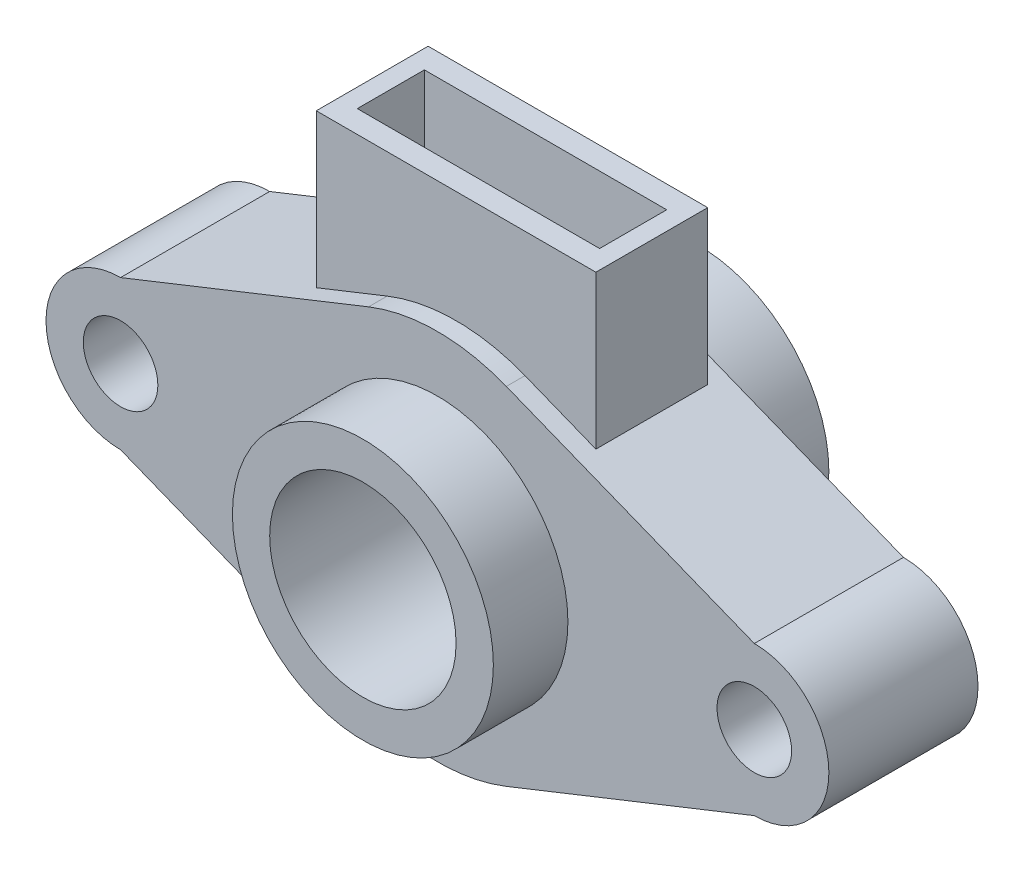
from build123d import *
from build123d.topology import SkipClean

# Parameters (mm, degrees)
SKETCH1_R                = 10
BOSS_EXTRUDE1_DEPTH      = 20
SKETCH2_R                = 35
SKETCH2_R_2              = 25
BOSS_EXTRUDE2_DEPTH      = 20
BOSS_EXTRUDE3_START      = 30
SKETCH3_R                = 35
SKETCH3_R_2              = 25
BOSS_EXTRUDE3_DEPTH      = 30
SKETCH4_R                = 25
CUT_EXTRUDE1_DEPTH       = 131.862523283
BOSS_EXTRUDE6_REACH      = 176.428
BOSS_EXTRUDE6_END_RADIUS = 50
SKETCH6_W                = 75
SKETCH6_H                = 30
SKETCH7_W                = 65
SKETCH7_H                = 18
CUT_EXTRUDE2_DEPTH       = 40


with BuildPart() as part:
    # Sketch1 → Boss-Extrude1 (new, symmetric)
    with BuildSketch(Plane.XY):
        with BuildLine():
            Line((-85, 20), (-18.480117336, 46.459501324))
            ThreePointArc((-18.480117336, 46.459501324), (0, 50), (18.480117336, 46.459501324))
            Line((18.480117336, 46.459501324), (85, 20))
            ThreePointArc((85, 20), (105, 0), (85, -20))
            Line((85, -20), (18.480117336, -46.459501324))
            ThreePointArc((18.480117336, -46.459501324), (0, -50), (-18.480117336, -46.459501324))
            Line((-18.480117336, -46.459501324), (-85, -20))
            ThreePointArc((-85, -20), (-105, 0), (-85, 20))
        make_face()
        with Locations((-85, 0)):
            Circle(SKETCH1_R, mode=Mode.SUBTRACT)
        with Locations((85, 0)):
            Circle(SKETCH1_R, mode=Mode.SUBTRACT)
    extrude(amount=BOSS_EXTRUDE1_DEPTH, both=True)

    # Sketch2 → Boss-Extrude2 (add)
    with BuildSketch(Plane.XY.offset(20)):
        Circle(SKETCH2_R)
        Circle(SKETCH2_R_2, mode=Mode.SUBTRACT)
    extrude(amount=BOSS_EXTRUDE2_DEPTH)

    # Sketch3 → Boss-Extrude3 (add)
    with BuildSketch(Plane(origin=(0, 0, -20), x_dir=(-1, 0, 0), z_dir=(0, 0, -1)).offset(BOSS_EXTRUDE3_START)):
        Circle(SKETCH3_R)
        Circle(SKETCH3_R_2, mode=Mode.SUBTRACT)
    extrude(amount=-BOSS_EXTRUDE3_DEPTH)

    # Sketch4 → Cut-Extrude1 (cut, through all)
    with BuildSketch(Plane(origin=(0, 0, -20), x_dir=(-1, 0, 0), z_dir=(0, 0, -1))):
        Circle(SKETCH4_R)
    extrude(amount=-CUT_EXTRUDE1_DEPTH, mode=Mode.SUBTRACT)

    # Boss-Extrude6: up to this cylinder (the profile starts outside it)
    with SkipClean():  # the faces are left unmerged after this step: merging them gives an invalid solid
        boss_extrude6_end = Plane(origin=(0, 0, 0), z_dir=(0, 0, -1)) * Cylinder(BOSS_EXTRUDE6_END_RADIUS, 453.856, mode=Mode.PRIVATE)
        # Sketch6 → Boss-Extrude6 (add, up to the surface)
        with BuildSketch(Plane(origin=(0, 80, 0), x_dir=(1, 0, 0), z_dir=(0, 1, 0)), mode=Mode.PRIVATE) as boss_extrude6_sk1:
            Rectangle(SKETCH6_W, SKETCH6_H)
        boss_extrude6_tool1 = extrude(boss_extrude6_sk1.sketch, amount=-BOSS_EXTRUDE6_REACH, mode=Mode.PRIVATE) - boss_extrude6_end
        add(boss_extrude6_tool1.solids().sort_by_distance((0, 80, 0))[0])
    add(part.part.scale(1), mode=Mode.REPLACE)  # the faces are merged on a copy

    # Sketch7 → Cut-Extrude2 (cut)
    with BuildSketch(Plane(origin=(0, 80, 0), x_dir=(1, 0, 0), z_dir=(0, 1, 0))):
        Rectangle(SKETCH7_W, SKETCH7_H)
    extrude(amount=-CUT_EXTRUDE2_DEPTH, mode=Mode.SUBTRACT)


solid = part.part
